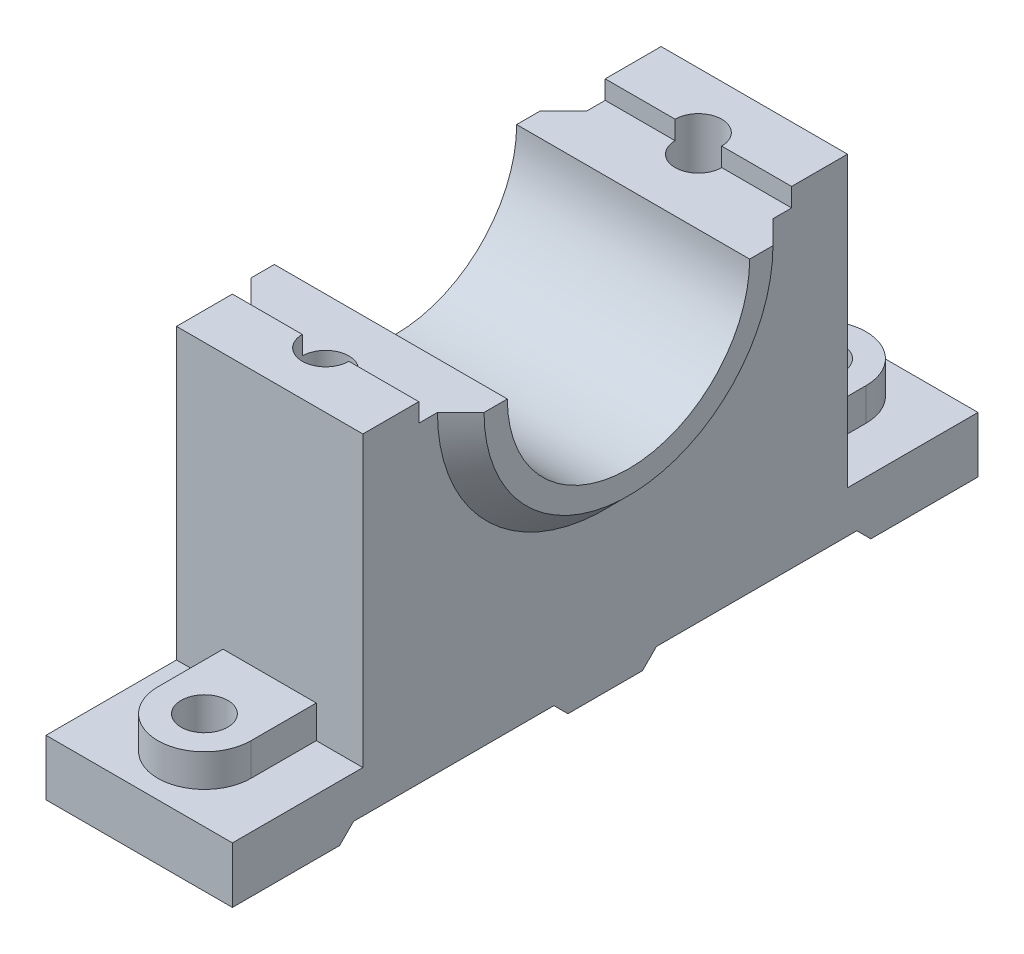
from build123d import *

# Parameters (mm, degrees)
BOSS_EXTRUDE1_DEPTH      = 10
BOSS_EXTRUDE2_DEPTH      = 20
SKETCH3_R                = 2.5
BOSS_EXTRUDE4_DEPTH      = 3.5
SKETCH5_R                = 2.5
CUT_EXTRUDE2_DEPTH       = 52.584881506
SKETCH6_R                = 13
CUT_EXTRUDE3_DEPTH       = 57.178287621
BOSS_EXTRUDE5_DEPTH      = 2.5
BOSS_EXTRUDE5_DEPTH_BACK = 22.5
SKETCH14_R               = 6.5
CUT_EXTRUDE6_DEPTH       = 6
BOSS_EXTRUDE6_DEPTH      = 2.5
BOSS_EXTRUDE6_DEPTH_BACK = 22.5
CHAMFER1_SIZE            = 2.5
SKETCH15_R               = 2.5
CUT_EXTRUDE7_DEPTH       = 30


with BuildPart() as part:
    # Sketch1 → Boss-Extrude1 (new, symmetric)
    with BuildSketch(Plane(origin=(0, 0, 0), x_dir=(0, 0, -1), z_dir=(1, 0, 0))):
        Polygon((-40, -3), (-28.5, -3), (-27, -1.5), (-5.5, -1.5), (-4, -3), (4, -3), (5.5, -1.5), (27, -1.5), (28.5, -3), (40, -3), (40, 3), (-40, 3), align=None)
    extrude(amount=BOSS_EXTRUDE1_DEPTH, both=True)

    # Sketch2 → Boss-Extrude2 (add)
    with BuildSketch(Plane(origin=(10, 0, 0), x_dir=(0, 0, -1), z_dir=(1, 0, 0))):
        Polygon((20, 32), (13, 32), (-13, 32), (-20, 32), (-20, 34), (-26, 34), (-26, 3), (26, 3), (26, 34), (20, 34), align=None)
    extrude(amount=-BOSS_EXTRUDE2_DEPTH)

    # Sketch3 → Boss-Extrude4 (add)
    # profile 1 of 2: a face of its own
    with BuildSketch(Plane(origin=(0, 3, 0), x_dir=(1, 0, 0), z_dir=(0, 1, 0))):
        with BuildLine():
            Line((-5, -33), (-5, -25))
            Line((-5, -25), (5, -25))
            Line((5, -25), (5, -33))
            ThreePointArc((5, -33), (0, -38), (-5, -33))
        make_face()
        with Locations(Location((0, -33, 0), (0, 0, 270))):
            Circle(SKETCH3_R, mode=Mode.SUBTRACT)
    # profile 2 of 2: a face of its own
    with BuildSketch(Plane(origin=(0, 3, 0), x_dir=(1, 0, 0), z_dir=(0, 1, 0))):
        with BuildLine():
            Line((5, 25), (5, 33))
            ThreePointArc((5, 33), (0, 38), (-5, 33))
            Line((-5, 33), (-5, 25))
            Line((-5, 25), (5, 25))
        make_face()
        with Locations(Location((0, 33, 0), (0, 0, 90))):
            Circle(SKETCH3_R, mode=Mode.SUBTRACT)
    extrude(amount=BOSS_EXTRUDE4_DEPTH)

    # Sketch5 → Cut-Extrude2 (cut, through all)
    with BuildSketch(Plane(origin=(0, 3, 0), x_dir=(1, 0, 0), z_dir=(0, 1, 0))):
        with Locations(Location((0, 33, 0), (0, 0, 90))):
            Circle(SKETCH5_R)
        with Locations(Location((0, -33, 0), (0, 0, 270))):
            Circle(SKETCH5_R)
    extrude(amount=-CUT_EXTRUDE2_DEPTH, mode=Mode.SUBTRACT)

    # Sketch6 → Cut-Extrude3 (cut, through all)
    with BuildSketch(Plane(origin=(10, 0, 0), x_dir=(0, 0, -1), z_dir=(1, 0, 0))):
        with Locations((0, 32)):
            Circle(SKETCH6_R)
    extrude(amount=-CUT_EXTRUDE3_DEPTH, mode=Mode.SUBTRACT)

    # Sketch8 → Boss-Extrude5 (add, two sides: drawn at the far end of the back side and taken through both)
    with BuildSketch(Plane(origin=(10, 0, 0), x_dir=(0, 0, -1), z_dir=(1, 0, 0)).offset(-BOSS_EXTRUDE5_DEPTH_BACK)):
        with BuildLine():
            Line((-13, 32), (-15, 32))
            ThreePointArc((-15, 32), (0, 17), (15, 32))
            Line((15, 32), (13, 32))
            ThreePointArc((13, 32), (0, 19), (-13, 32))
        make_face()
    extrude(amount=BOSS_EXTRUDE5_DEPTH + BOSS_EXTRUDE5_DEPTH_BACK)

    # Sketch14 → Cut-Extrude6 (cut)
    with BuildSketch(Plane.XZ.offset(1.5)):
        with Locations(Location((0, -20, 0), (0, 0, 270))):
            Circle(SKETCH14_R)
        with Locations(Location((0, 20, 0), (0, 0, 270))):
            Circle(SKETCH14_R)
    extrude(amount=-CUT_EXTRUDE6_DEPTH, mode=Mode.SUBTRACT)

    # Sketch10 → Boss-Extrude6 (add, two sides: drawn at the far end of the back side and taken through both)
    with BuildSketch(Plane(origin=(10, 0, 0), x_dir=(0, 0, -1), z_dir=(1, 0, 0)).offset(-BOSS_EXTRUDE6_DEPTH_BACK)):
        with BuildLine():
            Line((-18, 32), (-15, 32))
            ThreePointArc((-15, 32), (0, 17), (15, 32))
            Line((15, 32), (18, 32))
            ThreePointArc((18, 32), (0, 14), (-18, 32))
        make_face()
    extrude(amount=BOSS_EXTRUDE6_DEPTH + BOSS_EXTRUDE6_DEPTH_BACK)

    # Chamfer1
    chamfer1_edges = [part.edges().sort_by_distance(p)[0] for p in [
        (12.5, 14, 0),
        (-12.5, 14, 0),
    ]]
    chamfer(chamfer1_edges, length=CHAMFER1_SIZE - 0.0001)  # a hair under: the kernel refuses the full size

    # Sketch15 → Cut-Extrude7 (cut)
    with BuildSketch(Plane(origin=(0, 34, 0), x_dir=(1, 0, 0), z_dir=(0, 1, 0))):
        with Locations((0, -20)):
            Circle(SKETCH15_R)
        with Locations(Location((0, 20, 0), (0, 0, 180))):
            Circle(SKETCH15_R)
    extrude(amount=-CUT_EXTRUDE7_DEPTH, mode=Mode.SUBTRACT)


solid = part.part
